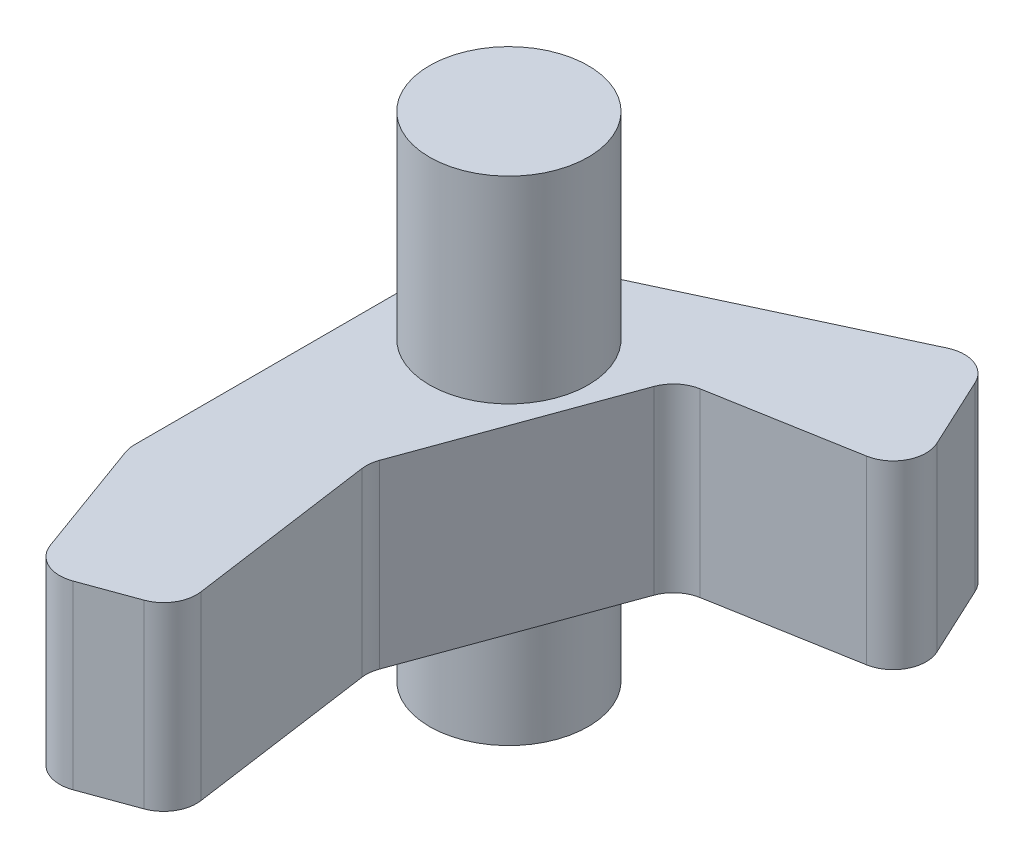
from build123d import *

# Parameters (mm, degrees)
BOSS_EXTRUDE3_DEPTH      = 2.2
CHAMFER2_SIZE            = 0.6
CHAMFER2_SIZE_2          = 2.822778066
FILLET1_R                = 0.4
BOSS_EXTRUDE4_DEPTH      = 4.6
BOSS_EXTRUDE4_DEPTH_BACK = 1.4
SKETCH2_R                = 0.965366887
FILLET2_R                = 1.2


with BuildPart() as part:
    # Sketch1 → Boss-Extrude3 (new body)
    with BuildSketch(Plane(origin=(0, 0, 0), x_dir=(1, 0, 0), z_dir=(0, 1, 0))):
        Polygon((5.086064398, 0.292080247), (4.289535013, 2.000243026), (0, 0), (0, -4.2), (0.684040287, -6.079385242), (2.563425528, -5.395344955), (1.63771199, -2.851967912), (2.624045016, -0.142040197), align=None)
    extrude(amount=BOSS_EXTRUDE3_DEPTH)

    # Chamfer2
    # the kernel refuses this chamfer: 2.822778066, 0.6 mm, written as the material it takes off along each edge
    with BuildSketch(Plane(origin=(2.563425528, -7.333289373, 5.395344955), x_dir=(-0.865629936296976, 0, 0.5006843450583344), z_dir=(0, 1, 0))) as chamfer2_piece_1_section:
        Polygon((CHAMFER2_SIZE * 0.984670194927, -CHAMFER2_SIZE * 0.174426509515), (-CHAMFER2_SIZE_2 * 0.174426509496, -CHAMFER2_SIZE_2 * 0.984670194818), (0, 0), align=None)
    chamfer2_piece_1 = extrude(amount=16.866578746, mode=Mode.PRIVATE)
    chamfer2_piece_1 = split(chamfer2_piece_1, bisect_by=Plane(origin=(1.145577622, 1.1, 4.204095975), z_dir=(0.93969262078591, 0, 0.3420201433256644)), keep=Keep.TOP, mode=Mode.PRIVATE)
    add(chamfer2_piece_1, mode=Mode.SUBTRACT)

    # Fillet1
    fillet1_edges = [part.edges().sort_by_distance(p)[0] for p in [
        (4.289535013, 1.1, -2.000243026),
        (5.086064398, 1.1, -0.292080247),
        (2.624045016, 1.1, 0.142040197),
        (0.684040287, 1.1, 6.079385242),
        (0, 1.1, 4.2),
        (1.999609956, 1.1, 5.600557041),
        (1.620115519, 1.1, 2.900313819),
    ]]
    fillet(fillet1_edges, radius=FILLET1_R)

    # Sketch2 → Boss-Extrude4 (add, two sides: drawn at the far end of the back side and taken through both)
    with BuildSketch(Plane(origin=(0, 0, 0), x_dir=(1, 0, 0), z_dir=(0, 1, 0)).offset(-BOSS_EXTRUDE4_DEPTH_BACK)):
        with Locations(Location((1.165366887, -0.742420587, 0), (0, 0, 270))):
            Circle(SKETCH2_R)
    extrude(amount=BOSS_EXTRUDE4_DEPTH + BOSS_EXTRUDE4_DEPTH_BACK)

    # Fillet2
    fillet2_edges = [part.edges().sort_by_distance(p)[0] for p in [
        (0, 1.1, 0),
    ]]
    fillet(fillet2_edges, radius=FILLET2_R)


solid = part.part
